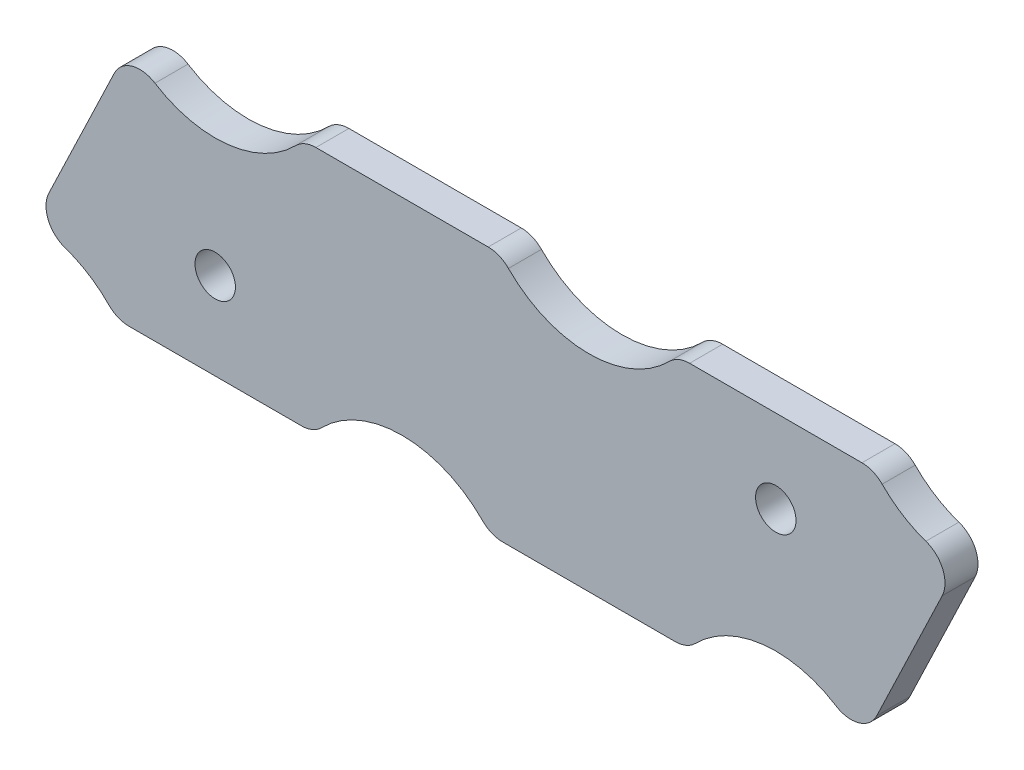
from build123d import *

# Parameters (mm, degrees)
BOSS_EXTRUDE1_DEPTH = 2.032
FILLET1_R           = 2
SKETCH4_R           = 1.2446
CUT_EXTRUDE1_DEPTH  = 75.115872934
CUT_EXTRUDE2_DEPTH  = 75.115872934


with BuildPart() as part:
    # Sketch3 → Boss-Extrude1 (new body)
    with BuildSketch(Plane.XY):
        with BuildLine():
            ThreePointArc((10.658308864, 17.473983742), (13.670205209, 16.817167392), (16.069205037, 14.88126266))
            Line((16.069205037, 14.88126266), (28.480794963, 14.88126266))
            ThreePointArc((28.480794963, 14.88126266), (33.775, 17.475), (39.069205037, 14.88126266))
            Line((39.069205037, 14.88126266), (51.480794963, 14.88126266))
            ThreePointArc((51.480794963, 14.88126266), (56.775, 17.475), (62.069205037, 14.88126266))
            Line((62.069205037, 14.88126266), (68.391691136, 28.076016258))
            ThreePointArc((68.391691136, 28.076016258), (65.379794791, 28.732832608), (62.980794963, 30.66873734))
            Line((62.980794963, 30.66873734), (50.569205037, 30.66873734))
            ThreePointArc((50.569205037, 30.66873734), (45.275, 28.075), (39.980794963, 30.66873734))
            Line((39.980794963, 30.66873734), (27.569205037, 30.66873734))
            ThreePointArc((27.569205037, 30.66873734), (22.275, 28.075), (16.980794963, 30.66873734))
            Line((16.980794963, 30.66873734), (10.658308864, 17.473983742))
        make_face()
    extrude(amount=BOSS_EXTRUDE1_DEPTH)

    # Fillet1
    fillet1_edges = [part.edges().sort_by_distance(p)[0] for p in [
        (62.980794963, 30.66873734, 1.016),
        (50.569205037, 30.66873734, 1.016),
        (39.980794963, 30.66873734, 1.016),
        (27.569205037, 30.66873734, 1.016),
        (16.069205037, 14.88126266, 1.016),
        (28.480794963, 14.88126266, 1.016),
        (39.069205037, 14.88126266, 1.016),
        (51.480794963, 14.88126266, 1.016),
        (68.391691136, 28.076016258, 1.016),
        (62.069205037, 14.88126266, 1.016),
        (10.658308864, 17.473983742, 1.016),
        (16.980794963, 30.66873734, 1.016),
    ]]
    fillet(fillet1_edges, radius=FILLET1_R)

    # Sketch4 → Cut-Extrude1 (cut, through all)
    with BuildSketch(Plane.XY.offset(2.032)):
        with Locations((22.275, 20.49206771)):
            Circle(SKETCH4_R)
        with Locations((56.775, 25.307013878)):
            Circle(SKETCH4_R)
    extrude(amount=-CUT_EXTRUDE1_DEPTH, mode=Mode.SUBTRACT)

    # Sketch6 → Cut-Extrude2 (cut, through all)
    with BuildSketch(Plane.XY.offset(2.032)):
        with BuildLine():
            Line((62.077939702, 30.66873734), (51.472060298, 30.66873734))
            ThreePointArc((51.472060298, 30.66873734), (50.699880618, 30.513659708), (50.047448735, 30.072475883))
            ThreePointArc((50.047448735, 30.072475883), (45.275, 28.075), (40.502551265, 30.072475883))
            ThreePointArc((40.502551265, 30.072475883), (39.850119382, 30.513659708), (39.077939702, 30.66873734))
            Line((39.077939702, 30.66873734), (28.472060298, 30.66873734))
            ThreePointArc((28.472060298, 30.66873734), (27.699880618, 30.513659708), (27.047448735, 30.072475883))
            ThreePointArc((27.047448735, 30.072475883), (23.046259875, 28.119539219), (18.704481797, 29.105661435))
            ThreePointArc((18.704481797, 29.105661435), (17.084104729, 29.334902549), (15.835023411, 28.277561926))
            Line((15.835023411, 28.277561926), (11.804080417, 19.865159157))
            ThreePointArc((11.804080417, 19.865159157), (11.762608918, 18.229172162), (12.956514205, 17.109902981))
            ThreePointArc((12.956514205, 17.109902981), (14.346493431, 16.443724254), (15.547448735, 15.477524117))
            ThreePointArc((15.547448735, 15.477524117), (16.199880618, 15.036340292), (16.972060298, 14.88126266))
            Line((16.972060298, 14.88126266), (27.577939702, 14.88126266))
            ThreePointArc((27.577939702, 14.88126266), (28.350119382, 15.036340292), (29.002551265, 15.477524117))
            ThreePointArc((29.002551265, 15.477524117), (33.775, 17.475), (38.547448735, 15.477524117))
            ThreePointArc((38.547448735, 15.477524117), (39.199880618, 15.036340292), (39.972060298, 14.88126266))
            Line((39.972060298, 14.88126266), (50.577939702, 14.88126266))
            ThreePointArc((50.577939702, 14.88126266), (51.350119382, 15.036340292), (52.002551265, 15.477524117))
            ThreePointArc((52.002551265, 15.477524117), (56.003740125, 17.430460781), (60.345518203, 16.444338565))
            ThreePointArc((60.345518203, 16.444338565), (61.965895271, 16.215097451), (63.214976589, 17.272438074))
            Line((63.214976589, 17.272438074), (67.245919583, 25.684840843))
            ThreePointArc((67.245919583, 25.684840843), (67.287391082, 27.320827838), (66.093485795, 28.440097019))
            ThreePointArc((66.093485795, 28.440097019), (64.703506569, 29.106275746), (63.502551265, 30.072475883))
            ThreePointArc((63.502551265, 30.072475883), (62.850119382, 30.513659708), (62.077939702, 30.66873734))
        make_face()
        with BuildLine():
            Line((16.064084682, 28.1678034), (12.033141688, 19.755400631))
            ThreePointArc((12.033141688, 19.755400631), (11.99693707, 18.327183984), (13.039216385, 17.350061989))
            ThreePointArc((13.039216385, 17.350061989), (14.481890346, 16.658628129), (15.728374403, 15.655798912))
            ThreePointArc((15.728374403, 15.655798912), (16.297947437, 15.270645433), (16.972060298, 15.13526266))
            Line((16.972060298, 15.13526266), (27.577939702, 15.13526266))
            ThreePointArc((27.577939702, 15.13526266), (28.252052563, 15.270645433), (28.821625597, 15.655798912))
            ThreePointArc((28.821625597, 15.655798912), (33.775, 17.729), (38.728374403, 15.655798912))
            ThreePointArc((38.728374403, 15.655798912), (39.297947437, 15.270645433), (39.972060298, 15.13526266))
            Line((39.972060298, 15.13526266), (50.577939702, 15.13526266))
            ThreePointArc((50.577939702, 15.13526266), (51.252052563, 15.270645433), (51.821625597, 15.655798912))
            ThreePointArc((51.821625597, 15.655798912), (55.974501318, 17.682772279), (60.480878147, 16.659265728))
            ThreePointArc((60.480878147, 16.659265728), (61.895467327, 16.459138236), (62.985915318, 17.3821966))
            Line((62.985915318, 17.3821966), (67.016858312, 25.794599369))
            ThreePointArc((67.016858312, 25.794599369), (67.05306293, 27.222816016), (66.010783615, 28.199938011))
            ThreePointArc((66.010783615, 28.199938011), (64.568109654, 28.891371871), (63.321625597, 29.894201088))
            ThreePointArc((63.321625597, 29.894201088), (62.752052563, 30.279354567), (62.077939702, 30.41473734))
            Line((62.077939702, 30.41473734), (51.472060298, 30.41473734))
            ThreePointArc((51.472060298, 30.41473734), (50.797947437, 30.279354567), (50.228374403, 29.894201088))
            ThreePointArc((50.228374403, 29.894201088), (45.275, 27.821), (40.321625597, 29.894201088))
            ThreePointArc((40.321625597, 29.894201088), (39.752052563, 30.279354567), (39.077939702, 30.41473734))
            Line((39.077939702, 30.41473734), (28.472060298, 30.41473734))
            ThreePointArc((28.472060298, 30.41473734), (27.797947437, 30.279354567), (27.228374403, 29.894201088))
            ThreePointArc((27.228374403, 29.894201088), (23.075498682, 27.867227721), (18.569121853, 28.890734272))
            ThreePointArc((18.569121853, 28.890734272), (17.154532673, 29.090861764), (16.064084682, 28.1678034))
        make_face(mode=Mode.SUBTRACT)
    extrude(amount=-CUT_EXTRUDE2_DEPTH, mode=Mode.SUBTRACT)


solid = part.part
